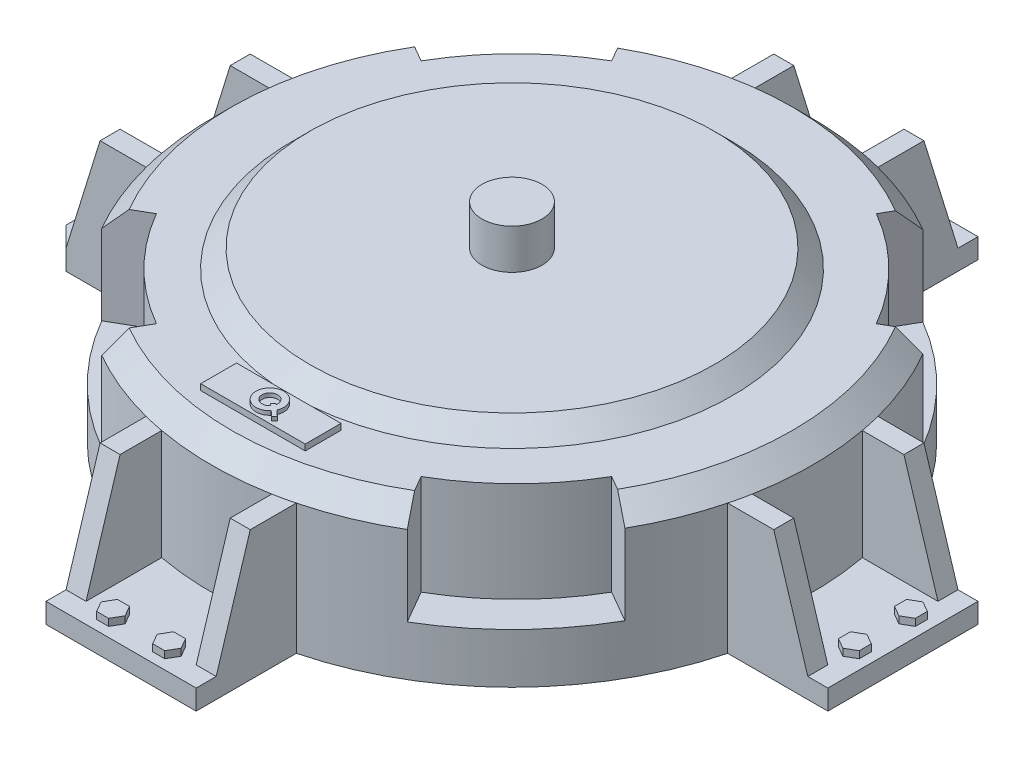
from build123d import *

# Parameters (mm, degrees)
SKETCH1_R                = 150
BOSS_EXTRUDE1_DEPTH      = 75
CHAMFER1_SIZE            = 10
BOSS_EXTRUDE2_START      = -75
BOSS_EXTRUDE2_DEPTH      = 10
CHAMFER2_SIZE            = 10
BOSS_EXTRUDE3_DEPTH      = 10
BOSS_EXTRUDE4_DEPTH      = 3.5
CIRPATTERN1_COUNT        = 4
CIRPATTERN1_COPY_1_DEPTH = 10
CIRPATTERN1_COPY_2_DEPTH = 10
CIRPATTERN1_COPY_3_DEPTH = 10
CIRPATTERN1_COPY_4_DEPTH = 3.5
CIRPATTERN1_COPY_5_DEPTH = 3.5
CIRPATTERN1_COPY_6_DEPTH = 3.5
CUT_EXTRUDE1_START       = -50
CUT_EXTRUDE1_DEPTH       = 50
CIRPATTERN2_COUNT        = 4
SKETCH7_R                = 110
BOSS_EXTRUDE5_DEPTH      = 9
BOSS_EXTRUDE5_TAPER      = 45
SKETCH8_R                = 15
BOSS_EXTRUDE6_DEPTH      = 20
SKETCH9_W                = 52.192884268
SKETCH9_H                = 17.88463766
BOSS_EXTRUDE7_DEPTH      = 3
BOSS_EXTRUDE8_DEPTH      = 2


# Read off the part's stored shape, not the designer's step: Cut-Extrude1
with BuildPart() as part:
    # Sketch1 → Boss-Extrude1 (new body)
    with BuildSketch(Plane(origin=(0, 0, 0), x_dir=(1, 0, 0), z_dir=(0, 1, 0))):
        with Locations(Location((0, 0, 0), (0, 0, 270))):
            Circle(SKETCH1_R)
    extrude(amount=BOSS_EXTRUDE1_DEPTH)

    # Chamfer1
    chamfer1_edges = [part.edges().sort_by_distance(p)[0] for p in [
        (0, 75, -150),
    ]]
    chamfer(chamfer1_edges, length=CHAMFER1_SIZE)

    # Sketch3 → Boss-Extrude2 (add)
    with BuildSketch(Plane(origin=(0, 75, 0), x_dir=(1, 0, 0), z_dir=(0, 1, 0)).offset(BOSS_EXTRUDE2_START)):
        with BuildLine():
            Line((-145.236875483, 37.5), (-195.236875483, 37.5))
            Line((-195.236875483, 37.5), (-195.236875483, -37.5))
            Line((-195.236875483, -37.5), (-145.236875483, -37.5))
            ThreePointArc((-145.236875483, -37.5), (-150, 0), (-145.236875483, 37.5))
        make_face()
    boss_extrude2 = extrude(amount=BOSS_EXTRUDE2_DEPTH)

    # Chamfer2
    chamfer2_edges = [part.edges().sort_by_distance(p)[0] for p in [
        (-195.236875483, 5, -37.5),
        (-195.236875483, 5, 37.5),
    ]]
    chamfer(chamfer2_edges, length=CHAMFER2_SIZE)

    # Sketch4 → Boss-Extrude3 (add)
    with BuildSketch(Plane.XY.offset(37.5)):
        Polygon((-185.236875483, 10), (-145.236875483, 10), (-145.236875483, 65), (-168.236875483, 65), align=None)
    boss_extrude3 = extrude(amount=-BOSS_EXTRUDE3_DEPTH)

    # Sketch5 → Boss-Extrude4 (add)
    with BuildSketch(Plane(origin=(0, 10, 0), x_dir=(1, 0, 0), z_dir=(0, 1, 0))):
        Polygon((-185.236875483, -20), (-180.04072306, -17), (-180.04072306, -11), (-185.236875483, -8), (-190.433027905, -11), (-190.433027905, -17), align=None)
    boss_extrude4 = extrude(amount=BOSS_EXTRUDE4_DEPTH)

    # Mirror1: Boss-Extrude3, Boss-Extrude4 across plane
    add(boss_extrude3.mirror(Plane.XY))
    add(boss_extrude4.mirror(Plane.XY))

    # CirPattern1: Boss-Extrude2, Boss-Extrude3, Boss-Extrude4 ×4 about axis
    cirpattern1_axis = Axis((0, 0, 0), (0, 1, 0))
    add([boss_extrude2.rotate(cirpattern1_axis, i * 360 / CIRPATTERN1_COUNT) for i in range(1, CIRPATTERN1_COUNT)])
    add([boss_extrude3.rotate(cirpattern1_axis, i * 360 / CIRPATTERN1_COUNT) for i in range(1, CIRPATTERN1_COUNT)])
    add([boss_extrude4.rotate(cirpattern1_axis, i * 360 / CIRPATTERN1_COUNT) for i in range(1, CIRPATTERN1_COUNT)])

    # CirPattern1 copy 1 sketch → CirPattern1 copy 1 (add)
    with BuildSketch(Plane(origin=(-37.5, 0, 0), x_dir=(0, 0, -1), z_dir=(-1, 0, 0))):
        Polygon((-185.236875483, -10), (-145.236875483, -10), (-145.236875483, -65), (-168.236875483, -65), align=None)
    extrude(amount=-CIRPATTERN1_COPY_1_DEPTH)

    # CirPattern1 copy 2 sketch → CirPattern1 copy 2 (add)
    with BuildSketch(Plane(origin=(0, 0, 37.5), x_dir=(-1, 0, 0), z_dir=(0, 0, 1))):
        Polygon((-185.236875483, -10), (-145.236875483, -10), (-145.236875483, -65), (-168.236875483, -65), align=None)
    extrude(amount=-CIRPATTERN1_COPY_2_DEPTH)

    # CirPattern1 copy 3 sketch → CirPattern1 copy 3 (add)
    with BuildSketch(Plane(origin=(37.5, 0, 0), x_dir=(0, 0, 1), z_dir=(1, 0, 0))):
        Polygon((-185.236875483, -10), (-145.236875483, -10), (-145.236875483, -65), (-168.236875483, -65), align=None)
    extrude(amount=-CIRPATTERN1_COPY_3_DEPTH)

    # CirPattern1 copy 4 sketch → CirPattern1 copy 4 (add)
    with BuildSketch(Plane(origin=(0, 10, 0), x_dir=(0, 0, -1), z_dir=(0, 1, 0))):
        Polygon((-185.236875483, 20), (-180.04072306, 17), (-180.04072306, 11), (-185.236875483, 8), (-190.433027905, 11), (-190.433027905, 17), align=None)
    extrude(amount=CIRPATTERN1_COPY_4_DEPTH)

    # CirPattern1 copy 5 sketch → CirPattern1 copy 5 (add)
    with BuildSketch(Plane(origin=(0, 10, 0), x_dir=(-1, 0, 0), z_dir=(0, 1, 0))):
        Polygon((-185.236875483, 20), (-180.04072306, 17), (-180.04072306, 11), (-185.236875483, 8), (-190.433027905, 11), (-190.433027905, 17), align=None)
    extrude(amount=CIRPATTERN1_COPY_5_DEPTH)

    # CirPattern1 copy 6 sketch → CirPattern1 copy 6 (add)
    with BuildSketch(Plane.ZX.offset(10)):
        Polygon((-185.236875483, 20), (-180.04072306, 17), (-180.04072306, 11), (-185.236875483, 8), (-190.433027905, 11), (-190.433027905, 17), align=None)
    extrude(amount=CIRPATTERN1_COPY_6_DEPTH)

    # Cut-Extrude1 outline → Cut-Extrude1 (cut)
    with BuildSketch(Plane(origin=(0, 75, 0), x_dir=(1, 0, 0), z_dir=(0, 1, 0)).offset(CUT_EXTRUDE1_START)):
        with BuildLine():
            ThreePointArc((-65, -112.583302492), (-91.923881554, -91.923881554), (-112.583302492, -65))
            Line((-112.583302492, -65), (-129.903810568, -75))
            ThreePointArc((-129.903810568, -75), (-106.066017178, -106.066017178), (-75, -129.903810568))
            Line((-75, -129.903810568), (-65, -112.583302492))
        make_face()
    cut_extrude1 = extrude(amount=CUT_EXTRUDE1_DEPTH, mode=Mode.SUBTRACT)

    # CirPattern2: Cut-Extrude1 ×4 about axis
    cirpattern2_axis = Axis((1.096442134, 0, -1.096442134), (0, 1, 0))
    for i in range(1, CIRPATTERN2_COUNT):
        add(cut_extrude1.rotate(cirpattern2_axis, i * 360 / CIRPATTERN2_COUNT), mode=Mode.SUBTRACT)

    # Sketch7 → Boss-Extrude5 (add)
    with BuildSketch(Plane(origin=(0, 75, 0), x_dir=(1, 0, 0), z_dir=(0, 1, 0))):
        Circle(SKETCH7_R)
    extrude(amount=BOSS_EXTRUDE5_DEPTH, taper=BOSS_EXTRUDE5_TAPER)

    # Sketch8 → Boss-Extrude6 (add)
    with BuildSketch(Plane(origin=(0, 84, 0), x_dir=(1, 0, 0), z_dir=(0, 1, 0))):
        with Locations(Location((0, 0, 0), (0, 0, 270))):
            Circle(SKETCH8_R)
    extrude(amount=BOSS_EXTRUDE6_DEPTH)

    # Sketch9 → Boss-Extrude7 (add)
    with BuildSketch(Plane(origin=(0, 75, 0), x_dir=(1, 0, 0), z_dir=(0, 1, 0))):
        with Locations((1.096442134, -121.525621322)):
            Rectangle(SKETCH9_W, SKETCH9_H)
    extrude(amount=BOSS_EXTRUDE7_DEPTH)

    # Sketch10 → Boss-Extrude8 (add)
    with BuildSketch(Plane(origin=(0, 78, 0), x_dir=(1, 0, 0), z_dir=(0, 1, 0))):
        with BuildLine():
            Line((6.270682812, -126.545342988), (8.874678556, -128.884668308))
            Line((8.874678556, -128.884668308), (10.207504523, -127.401046891))
            Line((10.207504523, -127.401046891), (7.367027593, -124.84927636))
            ThreePointArc((7.367027593, -124.84927636), (-4.827336948, -118.169160855), (6.270682812, -126.545342988))
        make_face()
        with BuildLine():
            Line((4.310616526, -122.103519263), (2.977790559, -123.58714068))
            Line((2.977790559, -123.58714068), (4.010713475, -124.515077192))
            ThreePointArc((4.010713475, -124.515077192), (-2.528998008, -120.272284372), (4.900321371, -122.63328644))
            Line((4.900321371, -122.63328644), (4.310616526, -122.103519263))
        make_face(mode=Mode.SUBTRACT)
    extrude(amount=BOSS_EXTRUDE8_DEPTH)


solid = part.part
